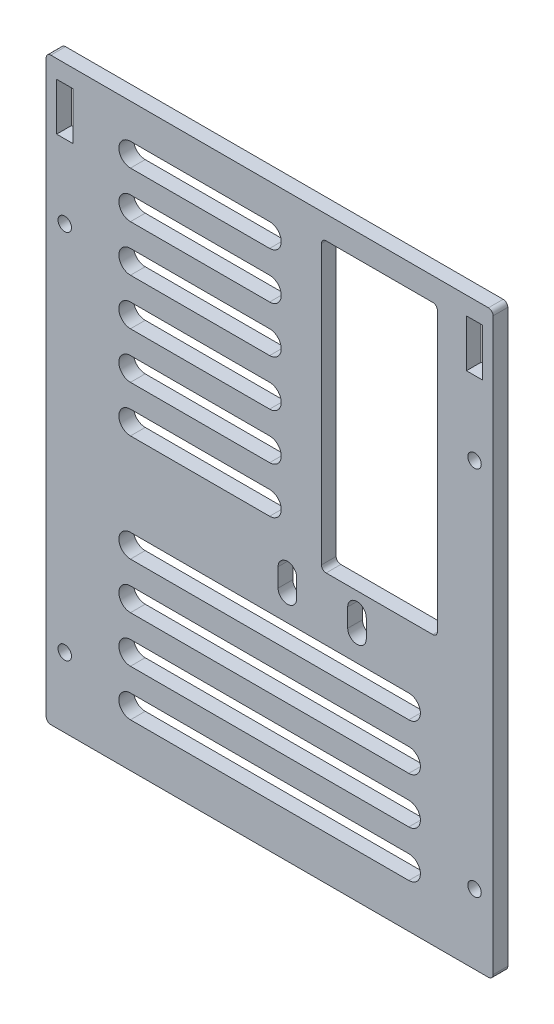
from build123d import *

# Parameters (mm, degrees)
STOCK_TORSO_REAR_PLATE_1_START       = -1.5875
STOCK_TORSO_REAR_PLATE_1_OUTLINE_W   = 96.34
STOCK_TORSO_REAR_PLATE_1_OUTLINE_H   = 125.5
STOCK_TORSO_REAR_PLATE_1_OUTLINE_R   = 1.45
STOCK_TORSO_REAR_PLATE_1_OUTLINE_W_2 = 3.4925
STOCK_TORSO_REAR_PLATE_1_OUTLINE_H_2 = 10.25
STOCK_TORSO_REAR_PLATE_1_DEPTH       = 3.175
MOVE_FACE1_BY                        = 0.5
CUT_EXTRUDE1_DEPTH                   = 158.576741701
CUT_EXTRUDE1_DEPTH_BACK              = 158.576741701
CUT_EXTRUDE2_DEPTH                   = 158.576741701
CUT_EXTRUDE2_DEPTH_BACK              = 158.576741701
SKETCH2_W                            = 25
SKETCH2_H                            = 62
FILLET1_R                            = 1
CUT_EXTRUDE3_DEPTH                   = 158.576741701
CUT_EXTRUDE3_DEPTH_BACK              = 158.576741701
FILLET2_R                            = 1


# Read off the part's stored shape, not the designer's step: Stock-torso_rear_plate-1
with BuildPart() as part:
    # Stock-torso_rear_plate-1 outline → Stock-torso_rear_plate-1 (new body)
    with BuildSketch(Plane.XY.offset(STOCK_TORSO_REAR_PLATE_1_START)):
        with Locations((0, 87.25)):
            Rectangle(STOCK_TORSO_REAR_PLATE_1_OUTLINE_W, STOCK_TORSO_REAR_PLATE_1_OUTLINE_H)
        with Locations((-44.17, 40)):
            Circle(STOCK_TORSO_REAR_PLATE_1_OUTLINE_R, mode=Mode.SUBTRACT)
        with BuildLine():
            Line((30, 34.5), (-30, 34.5))
            ThreePointArc((-30, 34.5), (-32.5, 37), (-30, 39.5))
            Line((-30, 39.5), (30, 39.5))
            ThreePointArc((30, 39.5), (32.5, 37), (30, 34.5))
        make_face(mode=Mode.SUBTRACT)
        with BuildLine():
            Line((30, 44.5), (-30, 44.5))
            ThreePointArc((-30, 44.5), (-32.5, 47), (-30, 49.5))
            Line((-30, 49.5), (30, 49.5))
            ThreePointArc((30, 49.5), (32.5, 47), (30, 44.5))
        make_face(mode=Mode.SUBTRACT)
        with Locations((44.17, 40)):
            Circle(STOCK_TORSO_REAR_PLATE_1_OUTLINE_R, mode=Mode.SUBTRACT)
        with BuildLine():
            ThreePointArc((-30, 54.5), (-32.5, 57), (-30, 59.5))
            Line((-30, 59.5), (30, 59.5))
            ThreePointArc((30, 59.5), (32.5, 57), (30, 54.5))
            Line((30, 54.5), (-30, 54.5))
        make_face(mode=Mode.SUBTRACT)
        with BuildLine():
            ThreePointArc((-30, 64.5), (-32.5, 67), (-30, 69.5))
            Line((-30, 69.5), (30, 69.5))
            ThreePointArc((30, 69.5), (32.5, 67), (30, 64.5))
            Line((30, 64.5), (-30, 64.5))
        make_face(mode=Mode.SUBTRACT)
        with Locations((-44.17, 120)):
            Circle(STOCK_TORSO_REAR_PLATE_1_OUTLINE_R, mode=Mode.SUBTRACT)
        with Locations((-44.17, 141)):
            Rectangle(STOCK_TORSO_REAR_PLATE_1_OUTLINE_W_2, STOCK_TORSO_REAR_PLATE_1_OUTLINE_H_2, mode=Mode.SUBTRACT)
        with Locations((44.17, 120)):
            Circle(STOCK_TORSO_REAR_PLATE_1_OUTLINE_R, mode=Mode.SUBTRACT)
        with Locations((44.17, 141)):
            Rectangle(STOCK_TORSO_REAR_PLATE_1_OUTLINE_W_2, STOCK_TORSO_REAR_PLATE_1_OUTLINE_H_2, mode=Mode.SUBTRACT)
    extrude(amount=STOCK_TORSO_REAR_PLATE_1_DEPTH)

    # Move Face1: a face moved inward by 0.5
    extrude(part.faces().sort_by_distance((0, 24.5, 0))[0], amount=MOVE_FACE1_BY, dir=(0, 1, 0), mode=Mode.SUBTRACT)

    # Sketch1 → Cut-Extrude1 (cut, two sides: drawn at the far end of the back side and taken through both)
    with BuildSketch(Plane.XY.offset(1.5875).offset(-CUT_EXTRUDE1_DEPTH_BACK)):
        with BuildLine():
            Line((1.83, 75), (1.83, 79))
            ThreePointArc((1.83, 79), (3.83, 81), (5.83, 79))
            Line((5.83, 79), (5.83, 75))
            ThreePointArc((5.83, 75), (3.83, 73), (1.83, 75))
        make_face()
        with BuildLine():
            Line((16.83, 75), (16.83, 79))
            ThreePointArc((16.83, 79), (18.83, 81), (20.83, 79))
            Line((20.83, 79), (20.83, 75))
            ThreePointArc((20.83, 75), (18.83, 73), (16.83, 75))
        make_face()
    extrude(amount=CUT_EXTRUDE1_DEPTH + CUT_EXTRUDE1_DEPTH_BACK, mode=Mode.SUBTRACT)

    # Sketch2 → Cut-Extrude2 (cut, two sides: drawn at the far end of the back side and taken through both)
    with BuildSketch(Plane(origin=(0, 0, -1.5875), x_dir=(-1, 0, 0), z_dir=(0, 0, -1)).offset(-CUT_EXTRUDE2_DEPTH_BACK)):
        with Locations((-23.67, 114)):
            Rectangle(SKETCH2_W, SKETCH2_H)
    extrude(amount=CUT_EXTRUDE2_DEPTH + CUT_EXTRUDE2_DEPTH_BACK, mode=Mode.SUBTRACT)

    # Fillet1
    fillet1_edges = [part.edges().sort_by_distance(p)[0] for p in [
        (36.17, 83, 0),
        (36.17, 145, 0),
        (11.17, 145, 0),
        (11.17, 83, 0),
    ]]
    fillet(fillet1_edges, radius=FILLET1_R)

    # Sketch3 → Cut-Extrude3 (cut, two sides: drawn at the far end of the back side and taken through both)
    with BuildSketch(Plane(origin=(0, 0, -1.5875), x_dir=(-1, 0, 0), z_dir=(0, 0, -1)).offset(-CUT_EXTRUDE3_DEPTH_BACK)):
        with BuildLine():
            Line((0, 92.5), (30, 92.5))
            ThreePointArc((30, 92.5), (32.5, 90), (30, 87.5))
            Line((30, 87.5), (0, 87.5))
            ThreePointArc((0, 87.5), (-2.5, 90), (0, 92.5))
        make_face()
        with BuildLine():
            Line((0, 102.5), (30, 102.5))
            ThreePointArc((30, 102.5), (32.5, 100), (30, 97.5))
            Line((30, 97.5), (0, 97.5))
            ThreePointArc((0, 97.5), (-2.5, 100), (0, 102.5))
        make_face()
        with BuildLine():
            Line((0, 112.5), (30, 112.5))
            ThreePointArc((30, 112.5), (32.5, 110), (30, 107.5))
            Line((30, 107.5), (0, 107.5))
            ThreePointArc((0, 107.5), (-2.5, 110), (0, 112.5))
        make_face()
        with BuildLine():
            Line((0, 122.5), (30, 122.5))
            ThreePointArc((30, 122.5), (32.5, 120), (30, 117.5))
            Line((30, 117.5), (0, 117.5))
            ThreePointArc((0, 117.5), (-2.5, 120), (0, 122.5))
        make_face()
        with BuildLine():
            Line((0, 132.5), (30, 132.5))
            ThreePointArc((30, 132.5), (32.5, 130), (30, 127.5))
            Line((30, 127.5), (0, 127.5))
            ThreePointArc((0, 127.5), (-2.5, 130), (0, 132.5))
        make_face()
        with BuildLine():
            Line((0, 142.5), (30, 142.5))
            ThreePointArc((30, 142.5), (32.5, 140), (30, 137.5))
            Line((30, 137.5), (0, 137.5))
            ThreePointArc((0, 137.5), (-2.5, 140), (0, 142.5))
        make_face()
    extrude(amount=CUT_EXTRUDE3_DEPTH + CUT_EXTRUDE3_DEPTH_BACK, mode=Mode.SUBTRACT)

    # Fillet2
    fillet2_edges = [part.edges().sort_by_distance(p)[0] for p in [
        (48.17, 25, 0),
        (-48.17, 25, 0),
        (48.17, 150, 0),
        (-48.17, 150, 0),
    ]]
    fillet(fillet2_edges, radius=FILLET2_R)


solid = part.part
